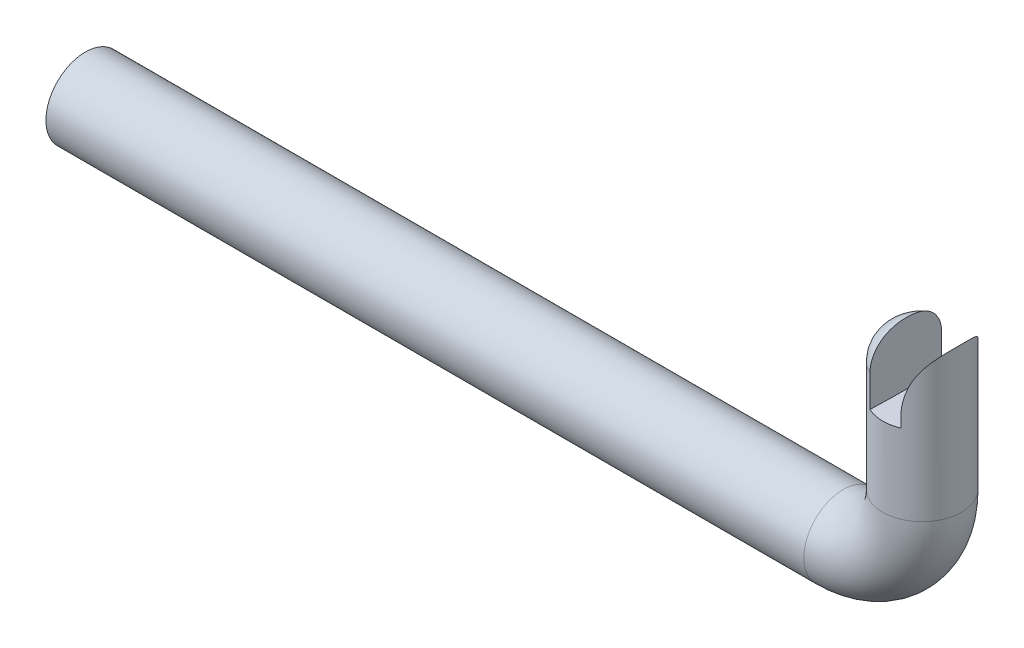
from build123d import *

# Parameters (mm, degrees)
SKETCH1_R                      = 3.175
BOSS_EXTRUDE1_START            = 5.08
BOSS_EXTRUDE1_DEPTH            = 5.08
BOSS_EXTRUDE2_REACH            = 74.32
BOSS_EXTRUDE2_END_MAJOR_RADIUS = 92.053833851
BOSS_EXTRUDE2_END_MINOR_RADIUS = 6.985
FILLET1_R                      = 2.54


with BuildPart() as part:
    # Sweep3: sweep along a path in Sketch2
    with BuildLine(Plane.XY) as sweep3_path:
        Line((0, 0), (60.96, 0))
        ThreePointArc((60.96, 0), (65.450128061, 1.859871939), (67.31, 6.35))
        Line((67.31, 6.35), (67.31, 12.7))
    # Sketch1 → Sweep3 (sweep)
    with BuildSketch(Plane(origin=(0, 0, 0), x_dir=(0, 0, -1), z_dir=(1, 0, 0))):
        Circle(SKETCH1_R)
    sweep(path=sweep3_path.line)

    # Sketch3 → Boss-Extrude1 (add)
    with BuildSketch(Plane(origin=(0, 12.7, 0), x_dir=(1, 0, 0), z_dir=(0, 1, 0)).offset(BOSS_EXTRUDE1_START)):
        with BuildLine():
            ThreePointArc((65.989488636, 2.88736467), (64.135, 0), (65.989488636, -2.88736467))
            ThreePointArc((65.989488636, -2.88736467), (66.04, 0), (65.989488636, 2.88736467))
        make_face()
    extrude(amount=-BOSS_EXTRUDE1_DEPTH)

    # Boss-Extrude2: up to this torus (the profile starts inside it)
    boss_extrude2_end = Plane(origin=(-16.51, 13.243362772, 0), z_dir=(0, -1, 0)) * Torus(BOSS_EXTRUDE2_END_MAJOR_RADIUS, BOSS_EXTRUDE2_END_MINOR_RADIUS, mode=Mode.PRIVATE)
    # Sketch4 → Boss-Extrude2 (add, up to the surface)
    with BuildSketch(Plane(origin=(0, 12.7, 0), x_dir=(1, 0, 0), z_dir=(0, 1, 0)), mode=Mode.PRIVATE) as boss_extrude2_sk1:
        with BuildLine():
            ThreePointArc((68.529488636, -2.931462513), (70.485, 0), (68.529488636, 2.931462513))
            ThreePointArc((68.529488636, 2.931462513), (68.58, 0), (68.529488636, -2.931462513))
        make_face()
    boss_extrude2_tool1 = extrude(boss_extrude2_sk1.sketch, amount=BOSS_EXTRUDE2_REACH, mode=Mode.PRIVATE) & boss_extrude2_end
    add(boss_extrude2_tool1.solids().sort_by_distance((69.356115, 12.7, 0))[0])

    # Fillet1
    # the kernel refuses this fillet: 2.54 mm, written as the material it takes off along each edge
    with BuildSketch(Plane(origin=(67.31, 17.78, 0), x_dir=(0.9999950652018583, 0, -0.0031415874858765833), z_dir=(0.0031415874858765833, 0, 0.9999950652018583))) as fillet1_piece_1_section:
        with BuildLine():
            CenterArc((3.175 - FILLET1_R, -FILLET1_R), FILLET1_R, 0, 90)
            Line((3.175 - FILLET1_R, 0), (3.175, 0))
            Line((3.175, 0), (3.175, -FILLET1_R))
        make_face()
    fillet1_piece_1 = revolve(axis=Axis((67.31, 17.78, 0), (0, 1, 0)), revolution_arc=359.64, mode=Mode.PRIVATE)
    fillet1_piece_1 = fillet1_piece_1 & Plane(origin=(-16.51, 16.807436712, 0), x_dir=(0.9993881118881123, 0, 0.03497716135872228), z_dir=(0, 1, 0)) * Cylinder(82.55, 13, mode=Mode.PRIVATE)
    add(fillet1_piece_1, mode=Mode.SUBTRACT)


solid = part.part
